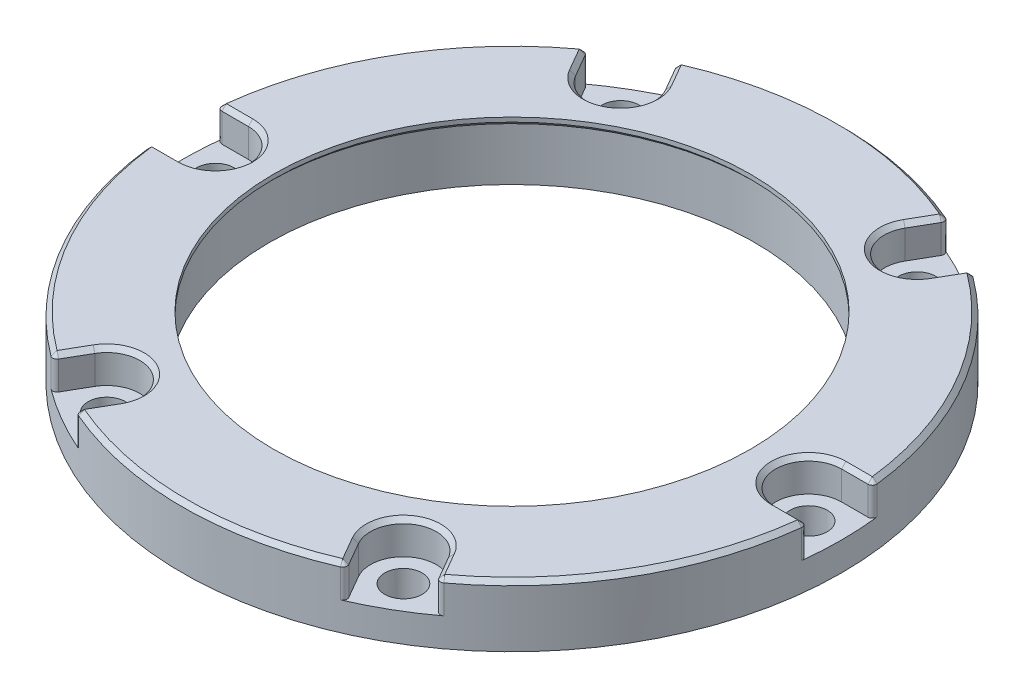
from build123d import *

# Parameters (mm, degrees)
M3_CLEARANCE_HOLE1_D = 3.4
CUT_EXTRUDE1_DEPTH   = 3
CIRPATTERN1_COUNT    = 6
FILLET2_R            = 0.4
CHAMFER1_SIZE        = 0.4


with BuildPart() as part:
    # Sketch5 → Revolve1 (revolve)
    with BuildSketch(Plane.XY, mode=Mode.PRIVATE) as revolve1_sk:
        Polygon((22.1, 0), (30, 0), (30, 5.6), (21.7, 5.6), (21.7, 5.2), (22.1, 4.8), align=None)
    revolve(revolve1_sk.sketch.rotate(Axis((0, 14.134935251, 0), (0, -1, 0)), 180), axis=Axis((0, 14.134935251, 0), (0, -1, 0)))

    # M3 Clearance Hole1 (through all)
    with Locations(Plane(origin=(0, 5.6, 0), x_dir=(1, 0, 0), z_dir=(0, 1, 0))):
        with Locations((27, 0)):
            m3_clearance_hole1 = Hole(M3_CLEARANCE_HOLE1_D / 2)

    # Sketch4 → Cut-Extrude1 (cut)
    with BuildSketch(Plane(origin=(0, 5.6, 0), x_dir=(1, 0, 0), z_dir=(0, 1, 0))):
        with BuildLine():
            Line((27, 3), (29.849623113, 3))
            ThreePointArc((29.849623113, 3), (30, 0), (29.849623113, -3))
            Line((29.849623113, -3), (27, -3))
            ThreePointArc((27, -3), (24, 0), (27, 3))
        make_face()
    cut_extrude1 = extrude(amount=-CUT_EXTRUDE1_DEPTH, mode=Mode.SUBTRACT)

    # CirPattern1: M3 Clearance Hole1, Cut-Extrude1 ×6 about axis
    cirpattern1_axis = Axis((0, 0, 0), (0, 1, 0))
    add([m3_clearance_hole1.rotate(cirpattern1_axis, i * 360 / CIRPATTERN1_COUNT) for i in range(1, CIRPATTERN1_COUNT)], mode=Mode.SUBTRACT)
    add([cut_extrude1.rotate(cirpattern1_axis, i * 360 / CIRPATTERN1_COUNT) for i in range(1, CIRPATTERN1_COUNT)], mode=Mode.SUBTRACT)

    # Fillet2
    fillet2_edges = [part.edges().sort_by_distance(p)[0] for p in [
        (-29.849623113, 4.1, 3),
        (-29.849623113, 4.1, -3),
        (-17.522887768, 4.1, -24.350531909),
        (-12.326735345, 4.1, -27.350531909),
        (12.326735345, 4.1, -27.350531909),
        (17.522887768, 4.1, -24.350531909),
        (29.849623113, 4.1, -3),
        (29.849623113, 4.1, 3),
        (17.522887768, 4.1, 24.350531909),
        (12.326735345, 4.1, 27.350531909),
        (-12.326735345, 4.1, 27.350531909),
        (-17.522887768, 4.1, 24.350531909),
    ]]
    fillet(fillet2_edges, radius=FILLET2_R)

    # Chamfer1
    chamfer1_edges = [part.edges().sort_by_distance(p)[0] for p in [
        (-24, 5.6, 0),
        (-28.202040675, 5.6, -3),
        (-12, 5.6, -20.784609691),
        (-11.502944126, 5.6, -25.923683663),
        (12, 5.6, -20.784609691),
        (16.699096549, 5.6, -22.923683663),
        (-11.502944126, 5.6, 25.923683663),
        (16.699096549, 5.6, 22.923683663),
        (25.980762114, 5.6, 15),
        (28.202040675, 5.6, -3),
        (25.980762114, 5.6, -15),
        (11.502944126, 5.6, -25.923683663),
        (0, 5.6, -30),
        (-16.699096549, 5.6, -22.923683663),
        (-25.980762114, 5.6, -15),
        (-28.202040675, 5.6, 3),
        (-25.980762114, 5.6, 15),
        (0, 5.6, 30),
        (17.565397878, 5.6, 24.156367596),
        (12.137329062, 5.6, 27.290264588),
        (29.702726941, 5.6, 3.133896992),
        (29.702726941, 5.6, -3.133896992),
        (17.565397878, 5.6, -24.156367596),
        (12.137329062, 5.6, -27.290264588),
        (-12.137329062, 5.6, -27.290264588),
        (-17.565397878, 5.6, -24.156367596),
        (-29.702726941, 5.6, -3.133896992),
        (-29.702726941, 5.6, 3.133896992),
        (-17.565397878, 5.6, 24.156367596),
        (-12.137329062, 5.6, 27.290264588),
        (24, 5.6, 0),
        (28.202040675, 5.6, 3),
        (12, 5.6, 20.784609691),
        (11.502944126, 5.6, 25.923683663),
        (-12, 5.6, 20.784609691),
        (-16.699096549, 5.6, 22.923683663),
    ]]
    chamfer(chamfer1_edges, length=CHAMFER1_SIZE - 0.0001)  # a hair under: the kernel refuses the full size


solid = part.part
